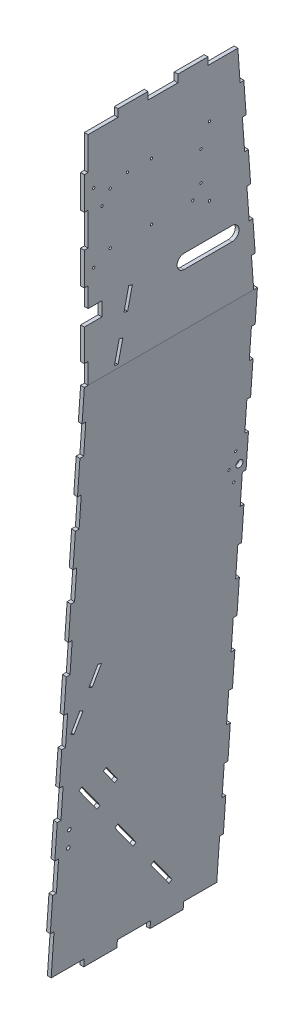
from build123d import *

# Parameters (mm, degrees)
BOSS_EXTRUDE1_DEPTH = 469.9
SKETCH2_W           = 10.16
SKETCH2_H           = 83.651125112
SKETCH2_H_2         = 83.677721465
SKETCH2_H_3         = 83.704317819
SKETCH2_H_4         = 83.730914172
SKETCH2_H_5         = 83.757510526
SKETCH2_H_6         = 83.784106879
SKETCH2_H_7         = 83.810703233
SKETCH2_H_8         = 133.264269193
CUT_EXTRUDE1_DEPTH  = 10.16
SKETCH3_W           = 10.16
SKETCH3_H           = 55.879999965
SKETCH3_H_2         = 88.9
SKETCH3_H_3         = 109.22
CUT_EXTRUDE2_DEPTH  = 12.7
SKETCH4_W           = 81.316938584
SKETCH4_H           = 20.32
SKETCH4_W_2         = 81.316938585
CUT_EXTRUDE3_DEPTH  = 12.7
SKETCH5_W           = 89.916
SKETCH5_H           = 20.32
CUT_EXTRUDE4_DEPTH  = 12.7
CUT_EXTRUDE5_DEPTH  = 137.414
SKETCH8_R           = 9.525
CUT_EXTRUDE7_DEPTH  = 2128.667464702
SKETCH13_W          = 47.788959893
SKETCH13_H          = 38.1
SKETCH13_R          = 3.175
CUT_EXTRUDE8_DEPTH  = 2128.667464702
CUT_EXTRUDE9_DEPTH  = 2128.667464702
SKETCH20_R          = 4.7625
CUT_EXTRUDE10_DEPTH = 2107.728843747
SKETCH23_R          = 3.175
CUT_EXTRUDE11_DEPTH = 2107.728843747


with BuildPart() as part:
    # Sketch1 → Boss-Extrude1 (new body)
    with BuildSketch(Plane.XY):
        Polygon((-215.881789204, 2052.32), (-215.881789204, 1463.040000035), (-316.088635901, 20.32), (-317.499999939, 0), (-307.333509538, 0), (-205.715298803, 1463.040000035), (-205.715298803, 2072.64), (-215.881789204, 2072.64), align=None)
    extrude(amount=-BOSS_EXTRUDE1_DEPTH)

    # Sketch2 → Cut-Extrude1 (cut)
    with BuildSketch(Plane(origin=(-315.975651309, 21.946686571, 0), x_dir=(0, 0, 1), z_dir=(-0.9975965627192115, 0.06928995634877068, 0))):
        with Locations((-464.82, 1313.852971026)):
            Rectangle(SKETCH2_W, SKETCH2_H)
        with Locations((-464.82, 1136.066269203)):
            Rectangle(SKETCH2_W, SKETCH2_H_2)
        with Locations((-464.82, 958.27956738)):
            Rectangle(SKETCH2_W, SKETCH2_H_3)
        with Locations((-464.82, 780.492865556)):
            Rectangle(SKETCH2_W, SKETCH2_H_4)
        with Locations((-464.82, 602.706163733)):
            Rectangle(SKETCH2_W, SKETCH2_H_5)
        with Locations((-464.82, 424.91946191)):
            Rectangle(SKETCH2_W, SKETCH2_H_6)
        with Locations((-464.82, 247.132760087)):
            Rectangle(SKETCH2_W, SKETCH2_H_7)
        with Locations((-464.82, 44.63257346)):
            Rectangle(SKETCH2_W, SKETCH2_H_8)
        with Locations((-5.08, 44.63257346)):
            Rectangle(SKETCH2_W, SKETCH2_H_8)
        with Locations((-5.08, 247.132760087)):
            Rectangle(SKETCH2_W, SKETCH2_H_7)
        with Locations((-5.08, 424.91946191)):
            Rectangle(SKETCH2_W, SKETCH2_H_6)
        with Locations((-5.08, 602.706163733)):
            Rectangle(SKETCH2_W, SKETCH2_H_5)
        with Locations((-5.08, 780.492865556)):
            Rectangle(SKETCH2_W, SKETCH2_H_4)
        with Locations((-5.08, 958.27956738)):
            Rectangle(SKETCH2_W, SKETCH2_H_3)
        with Locations((-5.08, 1136.066269203)):
            Rectangle(SKETCH2_W, SKETCH2_H_2)
        with Locations((-5.08, 1313.852971026)):
            Rectangle(SKETCH2_W, SKETCH2_H)
    extrude(amount=-CUT_EXTRUDE1_DEPTH, mode=Mode.SUBTRACT)

    # Sketch3 → Cut-Extrude2 (cut)
    with BuildSketch(Plane.ZY.offset(215.881789204)):
        with Locations((-5.08, 1490.980000018)):
            Rectangle(SKETCH3_W, SKETCH3_H)
        with Locations((-5.08, 1652.27)):
            Rectangle(SKETCH3_W, SKETCH3_H_2)
        Polygon((-469.9, 1463.040000035), (-459.713026258, 1463.040000035), (-453.620872406, 1546.589538567), (-463.753970086, 1547.328410273), (-457.607940173, 1631.616820512), (-447.474842492, 1630.877948806), (-441.328812579, 1715.166359045), (-451.461910259, 1715.905230751), (-445.315880346, 1800.19364099), (-435.182782665, 1799.454769284), (-429.036752752, 1883.743179522), (-439.169850432, 1884.482051228), (-433.023820518, 1968.770461467), (-422.890722838, 1968.031589761), (-415.263026258, 2072.64), (-469.9, 2072.64), align=None)
        with Locations((-5.08, 1830.07)):
            Rectangle(SKETCH3_W, SKETCH3_H_2)
        with Locations((-5.08, 2018.03)):
            Rectangle(SKETCH3_W, SKETCH3_H_3)
    extrude(amount=-CUT_EXTRUDE2_DEPTH, mode=Mode.SUBTRACT)

    # Sketch4 → Cut-Extrude3 (cut)
    with BuildSketch(Plane.ZY.offset(215.881789204)):
        with Locations((-376.086223632, 2062.48)):
            Rectangle(SKETCH4_W, SKETCH4_H)
        with Locations((-213.452346463, 2062.48)):
            Rectangle(SKETCH4_W_2, SKETCH4_H)
        with Locations((-50.818469292, 2062.48)):
            Rectangle(SKETCH4_W_2, SKETCH4_H)
    extrude(amount=-CUT_EXTRUDE3_DEPTH, mode=Mode.SUBTRACT)

    # Sketch5 → Cut-Extrude4 (cut)
    with BuildSketch(Plane(origin=(-315.975651309, 21.946686571, 0), x_dir=(0, 0, 1), z_dir=(-0.9975965627192115, 0.06928995634877068, 0))):
        with Locations((-414.782, -11.839561137)):
            Rectangle(SKETCH5_W, SKETCH5_H)
        with Locations((-234.95, -11.839561137)):
            Rectangle(SKETCH5_W, SKETCH5_H)
        with Locations((-55.118, -11.839561137)):
            Rectangle(SKETCH5_W, SKETCH5_H)
    extrude(amount=-CUT_EXTRUDE4_DEPTH, mode=Mode.SUBTRACT)

    # Sketch6 → Cut-Extrude5 (cut)
    with BuildSketch(Plane(origin=(-315.975651309, 21.946686571, 0), x_dir=(0, 0, 1), z_dir=(-0.9975965627192115, 0.06928995634877068, 0))):
        Polygon((-225.552848619, 218.022150673), (-217.372552167, 211.996509631), (-163.440168374, 285.214095065), (-171.620464825, 291.239736107), align=None)
        Polygon((-333.417616206, 71.586979805), (-325.230382227, 65.556228551), (-271.297998434, 138.773813985), (-279.485232413, 144.804565239), align=None)
        Polygon((-117.688081031, 364.457321541), (-109.500847052, 358.426570287), (-55.568463259, 431.644155721), (-63.755697238, 437.674906975), align=None)
        Polygon((-22.52887933, 586.435803877), (-44.10850301, 632.676529752), (-53.31924736, 628.378059234), (-31.73962368, 582.137333359), align=None)
        Polygon((-96.478494721, 720.859510985), (-74.89887104, 674.61878511), (-65.68812669, 678.917255627), (-87.26775037, 725.157981502), align=None)
    extrude(amount=-CUT_EXTRUDE5_DEPTH, mode=Mode.SUBTRACT)

    # Sketch8 → Cut-Extrude7 (cut, through all)
    with BuildSketch(Plane.ZY.offset(215.881789204)):
        with Locations((-450.215, 1043.94)):
            Circle(SKETCH8_R)
    extrude(amount=CUT_EXTRUDE7_DEPTH, mode=Mode.SUBTRACT)

    # Sketch13 → Cut-Extrude8 (cut, through all)
    with BuildSketch(Plane.ZY.offset(215.881789204)):
        with BuildLine():
            Line((-400.855976046, 1605.059439633), (-270.871476046, 1605.059439633))
            ThreePointArc((-270.871476046, 1605.059439633), (-251.821476046, 1624.109439633), (-270.871476046, 1643.159439633))
            Line((-270.871476046, 1643.159439633), (-400.855976046, 1643.159439633))
            ThreePointArc((-400.855976046, 1643.159439633), (-419.905976046, 1624.109439633), (-400.855976046, 1605.059439633))
        make_face()
        with Locations((-23.894479947, 1624.109439633)):
            Rectangle(SKETCH13_W, SKETCH13_H)
        with Locations((-25.246459893, 1731.87)):
            Circle(SKETCH13_R)
        with Locations((-70.408959893, 1755.42)):
            Circle(SKETCH13_R)
        with Locations((-182.408959893, 1755.42)):
            Circle(SKETCH13_R)
        with Locations((-25.246459893, 1918.97)):
            Circle(SKETCH13_R)
        with Locations((-47.788959893, 1865.42)):
            Circle(SKETCH13_R)
        with Locations((-182.408959893, 1910.42)):
            Circle(SKETCH13_R)
        with Locations((-117.078959893, 1910.42)):
            Circle(SKETCH13_R)
        with Locations((-70.408959893, 1895.42)):
            Circle(SKETCH13_R)
        with Locations((-317.028959893, 1865.42)):
            Circle(SKETCH13_R)
        with Locations((-294.408959893, 1755.42)):
            Circle(SKETCH13_R)
        with Locations((-317.028959893, 1785.42)):
            Circle(SKETCH13_R)
        with Locations((-339.571459893, 1731.87)):
            Circle(SKETCH13_R)
        with Locations((-339.571459893, 1918.97)):
            Circle(SKETCH13_R)
    extrude(amount=-CUT_EXTRUDE8_DEPTH, mode=Mode.SUBTRACT)

    # Sketch17 → Cut-Extrude9 (cut, through all)
    with BuildSketch(Plane.ZY.offset(215.881789204)):
        Polygon((-120.524654614, 1641.945974367), (-130.424254473, 1639.660471655), (-117.483615058, 1583.608404231), (-107.584015199, 1585.893906943), align=None)
        Polygon((-94.643375784, 1529.841839519), (-104.542975642, 1527.556336807), (-91.602336227, 1471.504269383), (-81.702736369, 1473.789772095), align=None)
    extrude(amount=-CUT_EXTRUDE9_DEPTH, mode=Mode.SUBTRACT)

    # Sketch20 → Cut-Extrude10 (cut, through all)
    with BuildSketch(Plane(origin=(-315.975651309, 21.946686571, 0), x_dir=(0, 0, 1), z_dir=(-0.9975965627192116, 0.06928995634876853, 0))):
        Polygon((-128.598334701, 451.361418049), (-162.492565561, 405.347250509), (-154.823537638, 399.698212032), (-120.929306778, 445.712379572), align=None)
        with Locations((-35.56, 347.287639338)):
            Circle(SKETCH20_R)
        with Locations((-35.56, 302.837639338)):
            Circle(SKETCH20_R)
    extrude(amount=-CUT_EXTRUDE10_DEPTH, mode=Mode.SUBTRACT)

    # Sketch23 → Cut-Extrude11 (cut, through all)
    with BuildSketch(Plane(origin=(-315.975651309, 21.946686571, 0), x_dir=(0, 0, 1), z_dir=(-0.9975965627192116, 0.06928995634876853, 0))):
        with Locations((-437.515, 986.355528037)):
            Circle(SKETCH23_R)
        with Locations((-421.64, 1024.455528037)):
            Circle(SKETCH23_R)
        with Locations((-437.515, 1062.555528037)):
            Circle(SKETCH23_R)
    extrude(amount=-CUT_EXTRUDE11_DEPTH, mode=Mode.SUBTRACT)


solid = part.part
